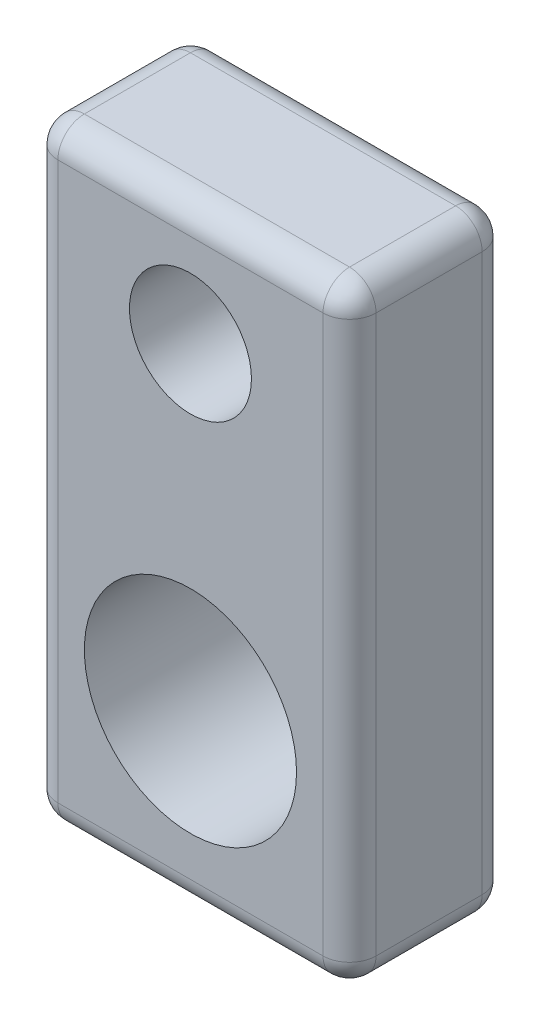
from build123d import *

# Parameters (mm, degrees)
SKETCH1_W           = 12
SKETCH1_H           = 23
BOSS_EXTRUDE1_DEPTH = 6
SKETCH2_R           = 2.3
SKETCH2_R_2         = 4
CUT_EXTRUDE1_DEPTH  = 6
FILLET1_R           = 1


with BuildPart() as part:
    # Sketch1 → Boss-Extrude1 (new body)
    with BuildSketch(Plane.XY):
        with Locations((6, 11.5)):
            Rectangle(SKETCH1_W, SKETCH1_H)
    extrude(amount=BOSS_EXTRUDE1_DEPTH)

    # Sketch2 → Cut-Extrude1 (cut)
    with BuildSketch(Plane.XY.offset(6)):
        with Locations((6, 18.5)):
            Circle(SKETCH2_R)
        with Locations((6, 6.5)):
            Circle(SKETCH2_R_2)
    extrude(amount=-CUT_EXTRUDE1_DEPTH, mode=Mode.SUBTRACT)

    # Fillet1
    fillet1_edges = [part.edges().sort_by_distance(p)[0] for p in [
        (6, 0, 6),
        (6, 0, 0),
        (0, 11.5, 6),
        (0, 0, 3),
        (0, 11.5, 0),
        (6, 23, 6),
        (0, 23, 3),
        (6, 23, 0),
        (12, 0, 3),
        (12, 11.5, 6),
        (12, 23, 3),
        (12, 11.5, 0),
    ]]
    fillet(fillet1_edges, radius=FILLET1_R)


solid = part.part
